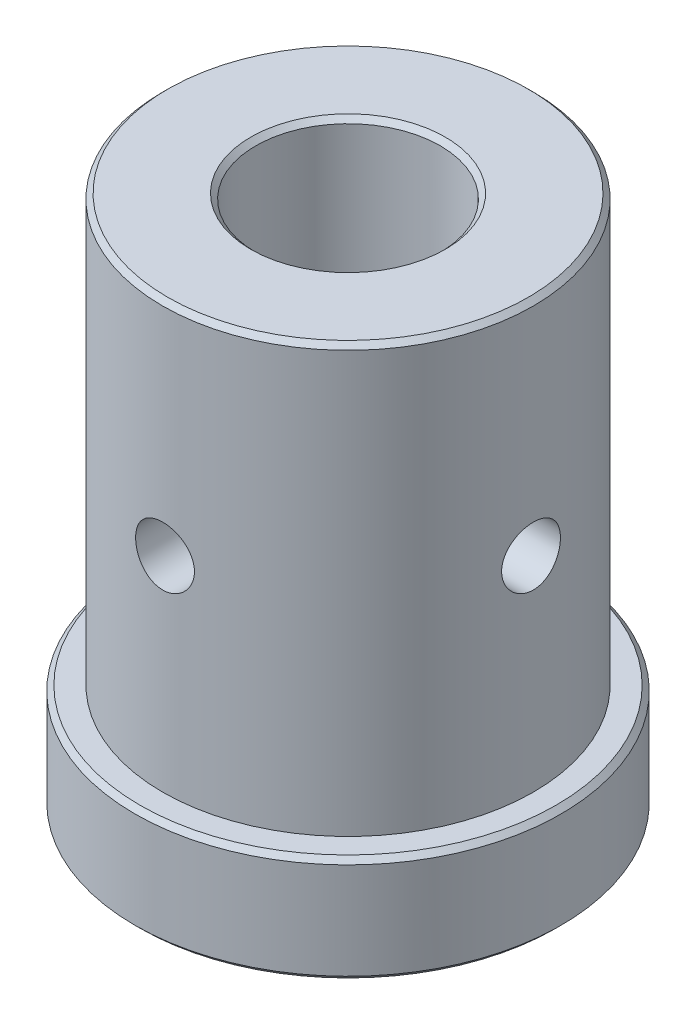
from build123d import *

# Parameters (mm, degrees)
SKETCH1_R               = 11.049
BOSS_EXTRUDE1_DEPTH     = 25.4
SKETCH2_R               = 12.7
BOSS_EXTRUDE2_DEPTH     = 6.35
SKETCH5_R               = 11.176
CUT_EXTRUDE2_DEPTH      = 5.545328
SKETCH6_R               = 7.27456
CUT_EXTRUDE3_DEPTH      = 0.1999996
SKETCH3_R               = 5.500000049
CUT_EXTRUDE1_DEPTH      = 37.477972806
CHAMFER1_SIZE           = 0.299999908
CUT_EXTRUDE4_DEPTH      = 32.108519733
CUT_EXTRUDE4_DEPTH_BACK = 32.108519733
SKETCH7_R               = 1.7526
CUT_EXTRUDE5_DEPTH      = 32.108519733
CUT_EXTRUDE5_DEPTH_BACK = 32.108519733
SKETCH8_R               = 1.7526


with BuildPart() as part:
    # Sketch1 → Boss-Extrude1 (new body)
    with BuildSketch(Plane(origin=(0, 0, 0), x_dir=(1, 0, 0), z_dir=(0, 1, 0))):
        Circle(SKETCH1_R)
    extrude(amount=BOSS_EXTRUDE1_DEPTH)

    # Sketch2 → Boss-Extrude2 (add)
    with BuildSketch(Plane.XZ):
        Circle(SKETCH2_R)
    extrude(amount=BOSS_EXTRUDE2_DEPTH)

    # Sketch5 → Cut-Extrude2 (cut)
    with BuildSketch(Plane.XZ.offset(6.35)):
        Circle(SKETCH5_R)
    extrude(amount=-CUT_EXTRUDE2_DEPTH, mode=Mode.SUBTRACT)

    # Sketch6 → Cut-Extrude3 (cut)
    with BuildSketch(Plane.XZ.offset(0.804672)):
        Circle(SKETCH6_R)
    extrude(amount=-CUT_EXTRUDE3_DEPTH, mode=Mode.SUBTRACT)

    # Sketch3 → Cut-Extrude1 (cut, through all)
    with BuildSketch(Plane.XZ.offset(6.35)):
        Circle(SKETCH3_R)
    extrude(amount=-CUT_EXTRUDE1_DEPTH, mode=Mode.SUBTRACT)

    # Chamfer1
    chamfer1_edges = [part.edges().sort_by_distance(p)[0] for p in [
        (-12.7, 0, 0),
        (-12.7, -6.35, 0),
        (-11.049, 25.4, 0),
        (-5.500000049, 25.4, 0),
        (-5.500000049, -0.6046724, 0),
        (-11.176, -6.35, 0),
    ]]
    chamfer(chamfer1_edges, length=CHAMFER1_SIZE)

    # Sketch7 → Cut-Extrude4 (cut, two sides: drawn at the far end of the back side and taken through both)
    with BuildSketch(Plane.XY.offset(-CUT_EXTRUDE4_DEPTH_BACK)):
        with Locations((0, 12.192)):
            Circle(SKETCH7_R)
    extrude(amount=CUT_EXTRUDE4_DEPTH + CUT_EXTRUDE4_DEPTH_BACK, mode=Mode.SUBTRACT)

    # Sketch8 → Cut-Extrude5 (cut, two sides: drawn at the far end of the back side and taken through both)
    with BuildSketch(Plane(origin=(0, 0, 0), x_dir=(0, 0, -1), z_dir=(1, 0, 0)).offset(-CUT_EXTRUDE5_DEPTH_BACK)):
        with Locations((0, 12.192)):
            Circle(SKETCH8_R)
    extrude(amount=CUT_EXTRUDE5_DEPTH + CUT_EXTRUDE5_DEPTH_BACK, mode=Mode.SUBTRACT)


solid = part.part
